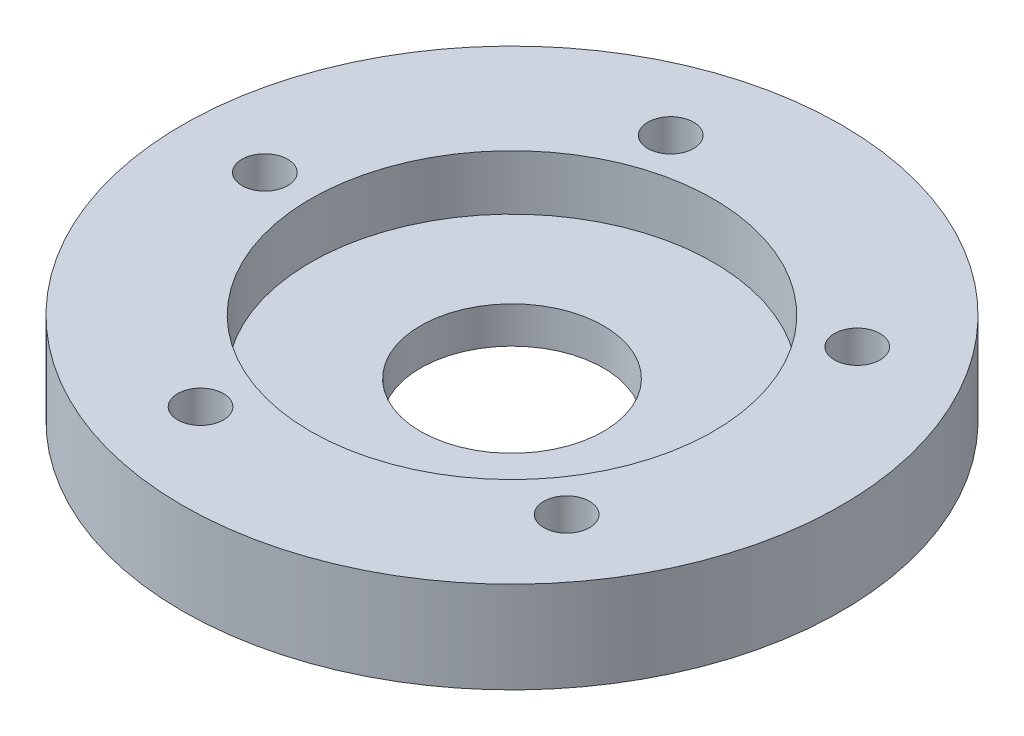
from build123d import *

# Parameters (mm, degrees)
BOSS_EXTRUDE1_DEPTH      = 2
BOSS_EXTRUDE1_DEPTH_BACK = 3
SKETCH1_R                = 16
SKETCH1_R_2              = 1.25
SKETCH1_R_3              = 1.75
SKETCH2_R                = 4.95
SKETCH2_R_2              = 2.95
BOSS_EXTRUDE3_DEPTH      = 3
SKETCH5_R                = 3.5
CUT_EXTRUDE2_DEPTH       = 4
SKETCH6_R                = 18
SKETCH6_R_2              = 16
BOSS_EXTRUDE4_DEPTH      = 5
CUT_EXTRUDE3_DEPTH       = 10
CUT_EXTRUDE3_DEPTH_BACK  = 3
SKETCH7_R                = 11
SKETCH8_R                = 5
CUT_EXTRUDE4_DEPTH       = 3


with BuildPart() as part:
    # Sketch1 → Boss-Extrude1 (new, two sides: drawn at the far end of the back side and taken through both)
    with BuildSketch(Plane(origin=(0, 0, 0), x_dir=(1, 0, 0), z_dir=(0, 1, 0)).offset(-BOSS_EXTRUDE1_DEPTH_BACK)):
        Circle(SKETCH1_R)
        with Locations((-13.5, 0)):
            Circle(SKETCH1_R_2, mode=Mode.SUBTRACT)
        with Locations((-4.171729424, 12.83926297)):
            Circle(SKETCH1_R_2, mode=Mode.SUBTRACT)
        with Locations((10.921729424, 7.935100906)):
            Circle(SKETCH1_R_2, mode=Mode.SUBTRACT)
        Circle(SKETCH1_R_3, mode=Mode.SUBTRACT)
        with Locations((-4.171729424, -12.83926297)):
            Circle(SKETCH1_R_2, mode=Mode.SUBTRACT)
        with Locations((10.921729424, -7.935100906)):
            Circle(SKETCH1_R_2, mode=Mode.SUBTRACT)
    extrude(amount=BOSS_EXTRUDE1_DEPTH + BOSS_EXTRUDE1_DEPTH_BACK)

    # Sketch2 → Boss-Extrude3 (add)
    with BuildSketch(Plane(origin=(0, 2, 0), x_dir=(1, 0, 0), z_dir=(0, 1, 0))):
        Circle(SKETCH2_R)
        Circle(SKETCH2_R_2, mode=Mode.SUBTRACT)
    extrude(amount=BOSS_EXTRUDE3_DEPTH)

    # Sketch5 → Cut-Extrude2 (cut)
    with BuildSketch(Plane.XZ.offset(3)):
        Circle(SKETCH5_R)
    extrude(amount=-CUT_EXTRUDE2_DEPTH, mode=Mode.SUBTRACT)

    # Sketch6 → Boss-Extrude4 (add)
    with BuildSketch(Plane(origin=(0, 2, 0), x_dir=(1, 0, 0), z_dir=(0, 1, 0))):
        Circle(SKETCH6_R)
        Circle(SKETCH6_R_2, mode=Mode.SUBTRACT)
    extrude(amount=-BOSS_EXTRUDE4_DEPTH)

    # Sketch7 → Cut-Extrude3 (cut, two sides: drawn at the far end of the back side and taken through both)
    with BuildSketch(Plane(origin=(0, 2, 0), x_dir=(1, 0, 0), z_dir=(0, 1, 0)).offset(-CUT_EXTRUDE3_DEPTH_BACK)):
        Circle(SKETCH7_R)
    extrude(amount=CUT_EXTRUDE3_DEPTH + CUT_EXTRUDE3_DEPTH_BACK, mode=Mode.SUBTRACT)

    # Sketch8 → Cut-Extrude4 (cut)
    with BuildSketch(Plane(origin=(0, -1, 0), x_dir=(1, 0, 0), z_dir=(0, 1, 0))):
        Circle(SKETCH8_R)
    extrude(amount=-CUT_EXTRUDE4_DEPTH, mode=Mode.SUBTRACT)


solid = part.part
